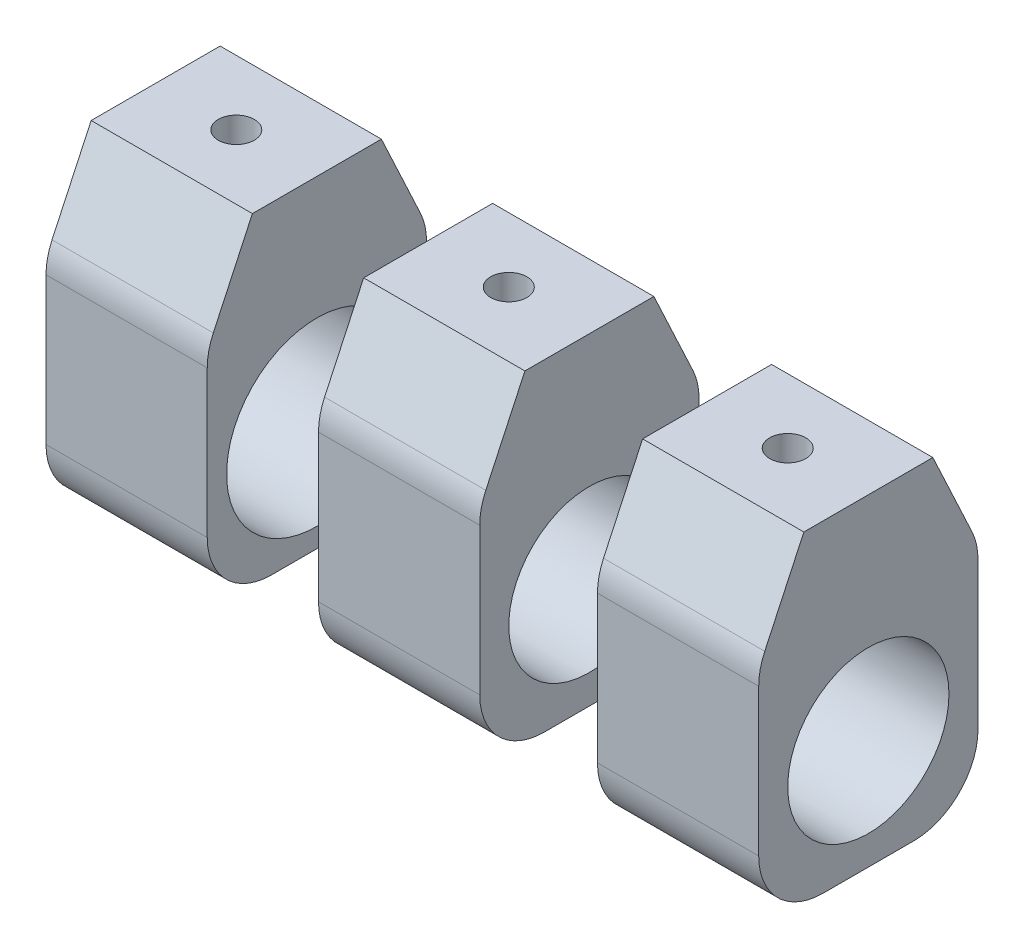
from build123d import *

# Parameters (mm, degrees)
SKETCH1_R              = 14
ZOOM_LENSE_MOUNT_DEPTH = 25
SPEC_START             = 42.25
SKETCH1_4_R            = 12.5
SPEC_MOUNT1_DEPTH      = 25
SPEC_START_2           = 85.5
SKETCH1_5_R            = 12.5
SPEC_MOUNT_2_DEPTH     = 25
FILLET1_R              = 10
FILLET2_R              = 10
FILLET3_R              = 10
SKETCH2_R              = 2.8
CUT_EXTRUDE1_DEPTH     = 30
SKETCH3_R              = 2.8
CUT_EXTRUDE2_DEPTH     = 30
SKETCH4_R              = 2.8
CUT_EXTRUDE3_DEPTH     = 30


with BuildPart() as part:
    # Sketch1 → zoom lense mount (new body)
    with BuildSketch(Plane(origin=(0, 0, 0), x_dir=(0, 0, -1), z_dir=(1, 0, 0))):
        Polygon((10, 33), (-10, 33), (-17, 18), (-17, -17), (17, -17), (17, 18), align=None)
        Circle(SKETCH1_R, mode=Mode.SUBTRACT)
    extrude(amount=ZOOM_LENSE_MOUNT_DEPTH)

    # Fillet1
    fillet1_edges = [part.edges().sort_by_distance(p)[0] for p in [
        (12.5, -17, -17),
        (12.5, 18, -17),
        (12.5, -17, 17),
        (12.5, 18, 17),
    ]]
    fillet(fillet1_edges, radius=FILLET1_R)

    # Sketch4 → Cut-Extrude3 (cut)
    with BuildSketch(Plane(origin=(0, 33, 0), x_dir=(1, 0, 0), z_dir=(0, 1, 0))):
        with Locations((12.5, 0)):
            Circle(SKETCH4_R)
    extrude(amount=-CUT_EXTRUDE3_DEPTH, mode=Mode.SUBTRACT)


with BuildPart() as body_2:
    # Sketch1<4> → spec mount1 (new body)
    with BuildSketch(Plane(origin=(0, 0, 0), x_dir=(0, 0, -1), z_dir=(1, 0, 0)).offset(SPEC_START)):
        Polygon((10, 33), (-10, 33), (-17, 18), (-17, -17), (17, -17), (17, 18), align=None)
        Circle(SKETCH1_4_R, mode=Mode.SUBTRACT)
    extrude(amount=SPEC_MOUNT1_DEPTH)

    # Fillet2
    fillet2_edges = [body_2.edges().sort_by_distance(p)[0] for p in [
        (54.75, -17, -17),
        (54.75, 18, -17),
        (54.75, -17, 17),
        (54.75, 18, 17),
    ]]
    fillet(fillet2_edges, radius=FILLET2_R)

    # Sketch3 → Cut-Extrude2 (cut)
    with BuildSketch(Plane(origin=(0, 33, 0), x_dir=(1, 0, 0), z_dir=(0, 1, 0))):
        with Locations((54.75, 0)):
            Circle(SKETCH3_R)
    extrude(amount=-CUT_EXTRUDE2_DEPTH, mode=Mode.SUBTRACT)


with BuildPart() as body_3:
    # Sketch1<5> → spec mount 2 (new body)
    with BuildSketch(Plane(origin=(0, 0, 0), x_dir=(0, 0, -1), z_dir=(1, 0, 0)).offset(SPEC_START_2)):
        Polygon((10, 33), (-10, 33), (-17, 18), (-17, -17), (17, -17), (17, 18), align=None)
        Circle(SKETCH1_5_R, mode=Mode.SUBTRACT)
    extrude(amount=SPEC_MOUNT_2_DEPTH)

    # Fillet3
    fillet3_edges = [body_3.edges().sort_by_distance(p)[0] for p in [
        (98, -17, -17),
        (98, 18, -17),
        (98, -17, 17),
        (98, 18, 17),
    ]]
    fillet(fillet3_edges, radius=FILLET3_R)

    # Sketch2 → Cut-Extrude1 (cut)
    with BuildSketch(Plane(origin=(0, 33, 0), x_dir=(1, 0, 0), z_dir=(0, 1, 0))):
        with Locations((98, 0)):
            Circle(SKETCH2_R)
    extrude(amount=-CUT_EXTRUDE1_DEPTH, mode=Mode.SUBTRACT)


solid = Compound([part.part, body_2.part, body_3.part])
